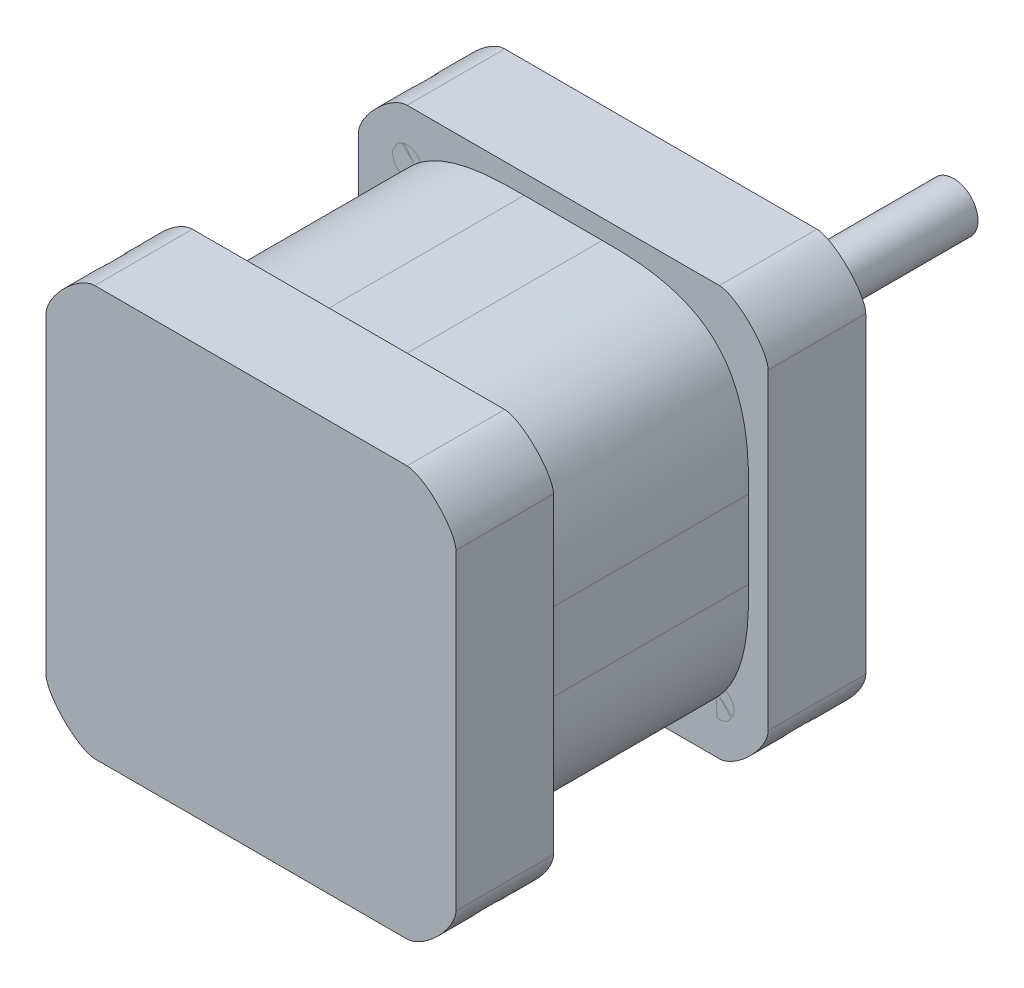
from build123d import *

# Parameters (mm, degrees)
BOSS_EXTRUDE1_START   = 10
SKETCH1_W             = 38
SKETCH1_H             = 38
BOSS_EXTRUDE1_DEPTH   = 22
SKETCH2_W             = 42
SKETCH2_H             = 42
BOSS_EXTRUDE2_DEPTH   = 10
BOSS_EXTRUDE3_START   = 32
SKETCH4_W             = 42
SKETCH4_H             = 42
BOSS_EXTRUDE3_DEPTH   = 10
FILLET1_SIZE          = 15
FILLET2_SIZE          = 5
SKETCH5_R             = 2.5
BOSS_EXTRUDE4_DEPTH   = 30
SKETCH6_R             = 1.5
BOSS_EXTRUDE5_DEPTH   = 10
SKETCH6_R_2           = 1.485008889
BOSS_EXTRUDE5_2_DEPTH = 10
BOSS_EXTRUDE5_3_DEPTH = 10
BOSS_EXTRUDE5_4_DEPTH = 10
SKETCH6_2_R           = 1.5
SKETCH6_2_R_2         = 1.485008889
CUT_EXTRUDE1_DEPTH    = 9


with BuildPart() as part:
    # Sketch1 → Boss-Extrude1 (new body)
    with BuildSketch(Plane.XY.offset(BOSS_EXTRUDE1_START)):
        Rectangle(SKETCH1_W, SKETCH1_H)
    extrude(amount=BOSS_EXTRUDE1_DEPTH)

    # Sketch2 → Boss-Extrude2 (add)
    with BuildSketch(Plane.XY):
        Rectangle(SKETCH2_W, SKETCH2_H)
    extrude(amount=BOSS_EXTRUDE2_DEPTH)

    # Sketch4 → Boss-Extrude3 (add)
    with BuildSketch(Plane.XY.offset(BOSS_EXTRUDE3_START)):
        Rectangle(SKETCH4_W, SKETCH4_H)
    extrude(amount=BOSS_EXTRUDE3_DEPTH)

    # Fillet1
    # a fillet whose section is not a circle: 15 mm, written as the material it takes off along each edge
    with BuildSketch(Plane(origin=(-19, 19, 10), x_dir=(1, 0, 0), z_dir=(0, 0, 1))) as fillet1_piece_1:
        with BuildLine():
            add(Edge.make_bspline([(FILLET1_SIZE, 0), (FILLET1_SIZE * 0.831801948466, 0), (FILLET1_SIZE * 0.663603896932, 0), (FILLET1_SIZE * 0.292893218813, -FILLET1_SIZE * 0.0716919198361), (FILLET1_SIZE * 0.0716919198361, -FILLET1_SIZE * 0.292893218813), (0, -FILLET1_SIZE * 0.663603896932), (0, -FILLET1_SIZE * 0.831801948466), (0, -FILLET1_SIZE)], knots=[0, 0, 0, 0, 0, 0, 0.5, 0.5, 1, 1, 1, 1, 1, 1], degree=5))
            Line((0, -FILLET1_SIZE), (-FILLET1_SIZE * 0.02, -FILLET1_SIZE))
            Line((-FILLET1_SIZE * 0.02, -FILLET1_SIZE), (-FILLET1_SIZE * 0.02, FILLET1_SIZE * 0.02))
            Line((-FILLET1_SIZE * 0.02, FILLET1_SIZE * 0.02), (FILLET1_SIZE, FILLET1_SIZE * 0.02))
            Line((FILLET1_SIZE, FILLET1_SIZE * 0.02), (FILLET1_SIZE, 0))
        make_face()
    extrude(amount=22, mode=Mode.SUBTRACT)
    with BuildSketch(Plane(origin=(-19, -19, 10), x_dir=(1, 0, 0), z_dir=(0, 0, 1)), Plane(origin=(19, -19, 10), x_dir=(0, 1, 0), z_dir=(0, 0, 1)), Plane(origin=(19, 19, 10), x_dir=(-1, 0, 0), z_dir=(0, 0, 1))) as fillet1_piece_2:
        with BuildLine():
            add(Edge.make_bspline([(FILLET1_SIZE, 0), (FILLET1_SIZE * 0.831801948466, 0), (FILLET1_SIZE * 0.663603896932, 0), (FILLET1_SIZE * 0.292893218813, FILLET1_SIZE * 0.0716919198361), (FILLET1_SIZE * 0.0716919198361, FILLET1_SIZE * 0.292893218813), (0, FILLET1_SIZE * 0.663603896932), (0, FILLET1_SIZE * 0.831801948466), (0, FILLET1_SIZE)], knots=[0, 0, 0, 0, 0, 0, 0.5, 0.5, 1, 1, 1, 1, 1, 1], degree=5))
            Line((0, FILLET1_SIZE), (-FILLET1_SIZE * 0.02, FILLET1_SIZE))
            Line((-FILLET1_SIZE * 0.02, FILLET1_SIZE), (-FILLET1_SIZE * 0.02, -FILLET1_SIZE * 0.02))
            Line((-FILLET1_SIZE * 0.02, -FILLET1_SIZE * 0.02), (FILLET1_SIZE, -FILLET1_SIZE * 0.02))
            Line((FILLET1_SIZE, -FILLET1_SIZE * 0.02), (FILLET1_SIZE, 0))
        make_face()
    extrude(amount=22, mode=Mode.SUBTRACT)

    # Fillet2
    # a fillet whose section is not a circle: 5 mm, written as the material it takes off along each edge
    with BuildSketch(Plane(origin=(-21, -21, 19.5), x_dir=(0, 1, 0), z_dir=(0, 0, 1)), Plane(origin=(-21, -21, -12.5), x_dir=(0, 1, 0), z_dir=(0, 0, 1)), Plane(origin=(-21, 21, -12.5), x_dir=(1, 0, 0), z_dir=(0, 0, 1)), Plane(origin=(-21, 21, 19.5), x_dir=(1, 0, 0), z_dir=(0, 0, 1))) as fillet2_piece_1:
        with BuildLine():
            Bezier((FILLET2_SIZE, 0), (0, 0), (0, -FILLET2_SIZE), weights=[1, 0.353553391, 1])
            Line((0, -FILLET2_SIZE), (0, 0))
            Line((0, 0), (FILLET2_SIZE, 0))
        make_face()
    extrude(amount=35, mode=Mode.SUBTRACT)
    with BuildSketch(Plane(origin=(21, -21, -12.5), x_dir=(0, 1, 0), z_dir=(0, 0, 1)), Plane(origin=(21, -21, 19.5), x_dir=(0, 1, 0), z_dir=(0, 0, 1)), Plane(origin=(21, 21, -12.5), x_dir=(-1, 0, 0), z_dir=(0, 0, 1)), Plane(origin=(21, 21, 19.5), x_dir=(-1, 0, 0), z_dir=(0, 0, 1))) as fillet2_piece_2:
        with BuildLine():
            Bezier((FILLET2_SIZE, 0), (0, 0), (0, FILLET2_SIZE), weights=[1, 0.353553391, 1])
            Line((0, FILLET2_SIZE), (0, 0))
            Line((0, 0), (FILLET2_SIZE, 0))
        make_face()
    extrude(amount=35, mode=Mode.SUBTRACT)

    # Sketch5 → Boss-Extrude4 (add)
    with BuildSketch(Plane.XY):
        Circle(SKETCH5_R)
    extrude(amount=-BOSS_EXTRUDE4_DEPTH)


with BuildPart() as body_2:
    # Sketch6 → Boss-Extrude5 (new body)
    with BuildSketch(Plane.XY):
        with Locations((16, 16)):
            Circle(SKETCH6_R)
    extrude(amount=BOSS_EXTRUDE5_DEPTH)


with BuildPart() as body_3:
    # Sketch6 → Boss-Extrude5 2 (new body)
    with BuildSketch(Plane.XY):
        with Locations((-16, 16)):
            Circle(SKETCH6_R_2)
    extrude(amount=BOSS_EXTRUDE5_2_DEPTH)


with BuildPart() as body_4:
    # Sketch6 → Boss-Extrude5 3 (new body)
    with BuildSketch(Plane.XY):
        with Locations((16, -16)):
            Circle(SKETCH6_R)
    extrude(amount=BOSS_EXTRUDE5_3_DEPTH)


with BuildPart() as body_5:
    # Sketch6 → Boss-Extrude5 4 (new body)
    with BuildSketch(Plane.XY):
        with Locations((-16, -16)):
            Circle(SKETCH6_R_2)
    extrude(amount=BOSS_EXTRUDE5_4_DEPTH)


with BuildPart() as cut_extrude1_tool:
    # Sketch6<2> → Cut-Extrude1 (new body)
    with BuildSketch(Plane.XY):
        with Locations((16, 16)):
            Circle(SKETCH6_2_R)
        with Locations((-16, 16)):
            Circle(SKETCH6_2_R_2)
        with Locations((16, -16)):
            Circle(SKETCH6_2_R)
        with Locations((-16, -16)):
            Circle(SKETCH6_2_R_2)
    extrude(amount=CUT_EXTRUDE1_DEPTH)


with BuildPart() as part_1:
    add(part.part)

    # Cut-Extrude1: cut by cut_extrude1_tool
    add(cut_extrude1_tool.part, mode=Mode.SUBTRACT)


with BuildPart() as body_2_1:
    add(body_2.part)

    # Cut-Extrude1: cut by cut_extrude1_tool
    add(cut_extrude1_tool.part, mode=Mode.SUBTRACT)


with BuildPart() as body_3_1:
    add(body_3.part)

    # Cut-Extrude1: cut by cut_extrude1_tool
    add(cut_extrude1_tool.part, mode=Mode.SUBTRACT)


with BuildPart() as body_4_1:
    add(body_4.part)

    # Cut-Extrude1: cut by cut_extrude1_tool
    add(cut_extrude1_tool.part, mode=Mode.SUBTRACT)


with BuildPart() as body_5_1:
    add(body_5.part)

    # Cut-Extrude1: cut by cut_extrude1_tool
    add(cut_extrude1_tool.part, mode=Mode.SUBTRACT)


solid = Compound([part_1.part, body_2_1.part, body_3_1.part, body_4_1.part, body_5_1.part])
